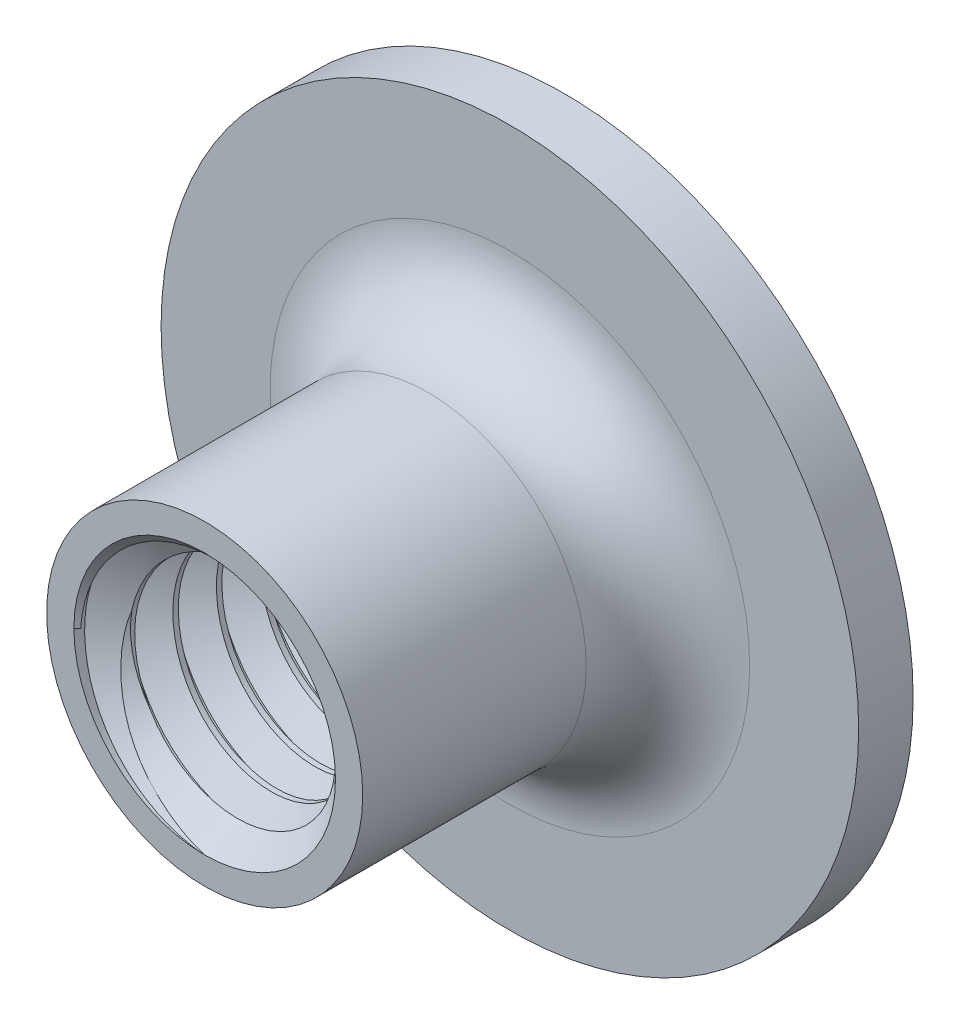
from build123d import *

# Parameters (mm, degrees)
SKETCH1_R          = 12.7
SKETCH1_R_2        = 4.7625
EXTRUDE1_DEPTH     = 1.984375
SKETCH2_R          = 5.7546875
SKETCH2_R_2        = 4.7625
EXTRUDE2_DEPTH     = 11.1125
SWEEP1_PITCH       = 1.5875
SKETCH5_R          = 12.7
CUT_EXTRUDE1_DEPTH = 23.950329269
SKETCH7_R          = 5.7546875
CUT_EXTRUDE3_DEPTH = 23.228543303
FILLET1_R          = 2.9765625


with BuildPart() as part:
    # Sketch1 → Extrude1 (new body)
    with BuildSketch(Plane.XY):
        Circle(SKETCH1_R)
        Circle(SKETCH1_R_2, mode=Mode.SUBTRACT)
    extrude(amount=EXTRUDE1_DEPTH)

    # Sketch2 → Extrude2 (add)
    with BuildSketch(Plane.XY.offset(1.984375)):
        Circle(SKETCH2_R)
        Circle(SKETCH2_R_2, mode=Mode.SUBTRACT)
    extrude(amount=EXTRUDE2_DEPTH)

    # Sweep1: the profile of Sketch4 profile screwed along a right-hand helix of 9 turns, 6 arcs to a turn; built about Z, then put on its axis
    sweep1_z = Axis((0, 0, 0), (0, 0, 1))
    sweep1_corners = [(4.7628, 0, -1.389235705), (4.7628, 0, 0.000173205), (3.731388504, 0, -0.5953125), (3.731388504, 0, -0.79375)]
    with BuildLine(mode=Mode.PRIVATE) as sweep1_profile:
        Line(sweep1_corners[0], sweep1_corners[1])
        Line(sweep1_corners[1], sweep1_corners[2])
        Line(sweep1_corners[2], sweep1_corners[3])
        Line(sweep1_corners[3], sweep1_corners[0])
    sweep1_cap = Face(sweep1_profile.wire())
    sweep1_turn_angles = [0, 30, 60, 90, 120, 150, 180, 210, 240, 270, 300, 330, 360]
    sweep1_turn_weights = [1, 0.8660254037844387, 1, 0.8660254037844387, 1, 0.8660254037844387, 1, 0.8660254037844387, 1, 0.8660254037844387, 1, 0.8660254037844387, 1]
    sweep1_turn_rails = [Edge.make_bspline([Vector(p[0], p[1], 0).rotate(sweep1_z, sweep1_turn_angles[k]) / sweep1_turn_weights[k] + Vector(0, 0, p[2] + SWEEP1_PITCH * sweep1_turn_angles[k] / 360) for k in range(13)], [0, 0, 0, 1, 1, 2, 2, 3, 3, 4, 4, 5, 5, 6, 6, 6], 2, sweep1_turn_weights) for p in sweep1_corners]
    sweep1_turn_sides = [Face.make_surface_from_curves(sweep1_turn_rails[p[0]], sweep1_turn_rails[p[1]]) for p in [(0, 1), (1, 2), (2, 3), (3, 0)]]
    sweep1 = Plane(origin=(0, 0, 0), x_dir=(-1, 0, 0), z_dir=(0, 0, 1)) * Solid(Shell([*[p.moved(Location((0, 0, SWEEP1_PITCH * i))) for i in range(9) for p in sweep1_turn_sides], sweep1_cap, sweep1_cap.rotate(sweep1_z, 3240).moved(Location((0, 0, SWEEP1_PITCH * 3240 / 360)))]))
    add(sweep1)

    # Sketch5 → Cut-Extrude1 (cut, through all)
    with BuildSketch(Plane(origin=(0, 0, 0), x_dir=(-1, 0, 0), z_dir=(0, 0, -1))):
        with Locations(Location((0, 0, 0), (0, 0, 180))):
            Circle(SKETCH5_R)
    extrude(amount=CUT_EXTRUDE1_DEPTH, mode=Mode.SUBTRACT)

    # Cut-Extrude2 cone 1 section (through the dimple's axis) → Cut-Extrude2 (revolve, cut)
    with BuildSketch(Plane.YZ):
        Polygon((0, 0), (4.7625, 0), (0, 4.7625), align=None)
    revolve(axis=Axis((0, 0, 0), (0, 0, 1)), mode=Mode.SUBTRACT)

    # Sketch7 → Cut-Extrude3 (cut, through all)
    with BuildSketch(Plane.XY.offset(13.096875)):
        Circle(SKETCH7_R)
    extrude(amount=CUT_EXTRUDE3_DEPTH, mode=Mode.SUBTRACT)

    # Cut-Extrude4 cone 1 section (through the dimple's axis) → Cut-Extrude4 (revolve, cut)
    with BuildSketch(Plane(origin=(0, 0, 13.096875), x_dir=(0, -1, 0), z_dir=(1, 0, 0))):
        Polygon((0, 0), (4.7625, 0), (0, 4.7625), align=None)
    revolve(axis=Axis((0, 0, 13.096875), (0, 0, -1)), mode=Mode.SUBTRACT)

    # Fillet1
    fillet1_edges = [part.edges().sort_by_distance(p)[0] for p in [
        (-5.7546875, 0, 1.984375),
    ]]
    fillet(fillet1_edges, radius=FILLET1_R)


solid = part.part
